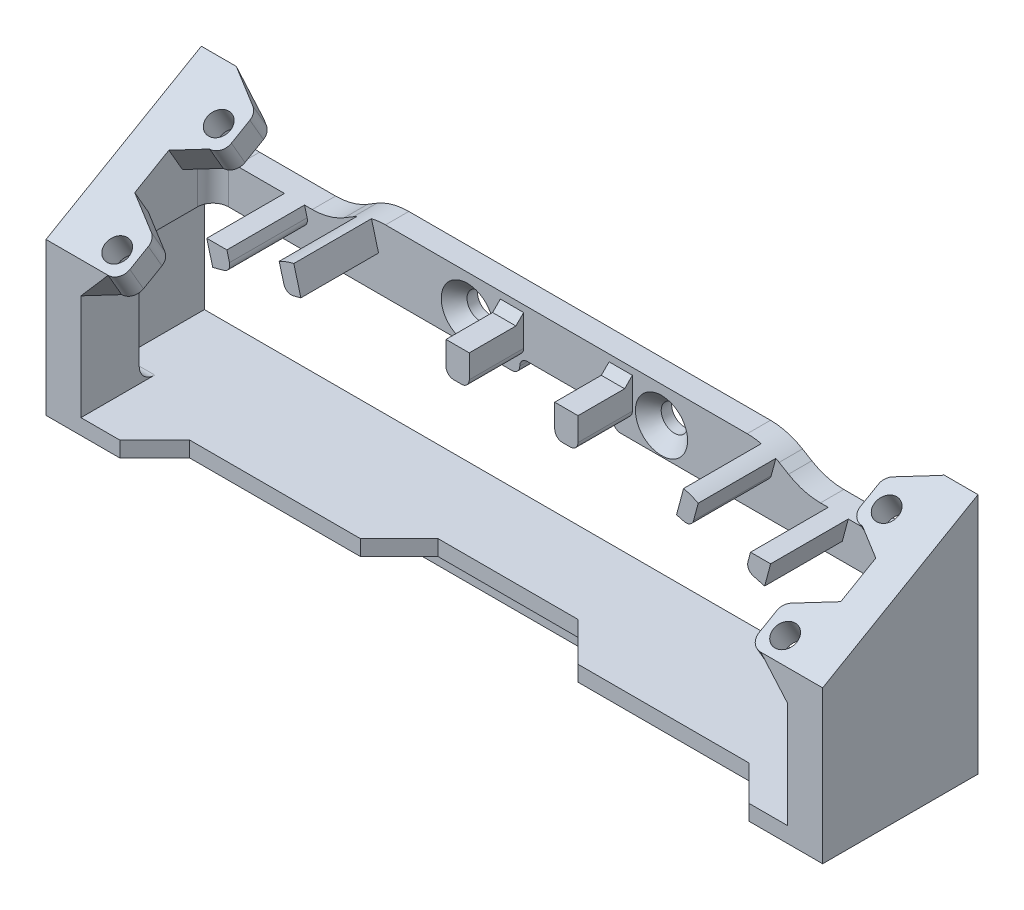
from build123d import *
from OCP.BRepFilletAPI import BRepFilletAPI_MakeChamfer

# Parameters (mm, degrees)
RESSALTO_EXTRUS_O1_DEPTH  = 20
RESSALTO_EXTRUS_O2_DEPTH  = 100
CORTE_EXTRUS_O1_DEPTH     = 100
ESBO_O5_W                 = 91.00000000000001
ESBO_O5_H                 = 5.137292932083099
CORTE_EXTRUS_O2_DEPTH     = 100
CORTE_EXTRUS_O3_DEPTH     = 100
CORTE_EXTRUS_O4_DEPTH     = 100
CORTE_EXTRUS_O5_DEPTH     = 100
RESSALTO_EXTRUS_O6_DEPTH  = 3
FILETE3_R                 = 3
FILETE4_R                 = 8
ESBO_O16_W                = 5
ESBO_O16_H                = 5
ESBO_O16_R                = 1.5000000000000009
ESBO_O16_R_2              = 1.5000000000000042
RESSALTO_EXTRUS_O8_DEPTH  = 3.5
CHANFRO1_SIZE             = 3
CHANFRO1_SIZE_2           = 5.196152423
CHANFRO2_SIZE             = 5
CHANFRO2_SIZE_2           = 2.886751346
FILETE5_R                 = 2
ESBO_O20_W                = 12
ESBO_O20_H                = 2
CORTE_EXTRUS_O6_DEPTH     = 3.5
FILETE6_R                 = 1
ESBO_O21_R                = 2.0000000000000013
ESBO_O21_R_2              = 2.0000000000000036
RESSALTO_EXTRUS_O9_DEPTH  = 3.5
CHANFRO3_SIZE             = 2
CHANFRO3_SIZE2            = 3.4641016151377735
CHANFRO4_SIZE             = 3.5
CHANFRO4_SIZE2            = 2.0207259421636956
CHANFRO5_SIZE             = 2
CHANFRO5_SIZE2            = 3.464101615137773
FILETE7_R                 = 1.5
FILETE8_R                 = 1.5
FILETE9_R                 = 1.5
FILETE10_R                = 2
RESSALTO_EXTRUS_O10_START = 10
RESSALTO_EXTRUS_O10_DEPTH = 10
RESSALTO_EXTRUS_O11_DEPTH = 7
CHANFRO6_SIZE             = 1
RESSALTO_EXTRUS_O12_DEPTH = 0.4
RESSALTO_EXTRUS_O13_DEPTH = 0.4


# Read off the part's stored shape, not the designer's step: Escareado para parafuso Allen sextavado escareado de M32
# Some blends are built 0.0001 mm under size
with BuildPart() as part:
    # Esboço1 → Ressalto-extrusão1 (new body)
    with BuildSketch(Plane.XY):
        Polygon((-34.51828410689169, -80.8139786444684), (-34.518284106891684, -114.0325026371303), (65.4817158931083, -114.0325026371303), (65.4817158931083, -112.03250263713029), (65.4817158931083, -80.81397864446838), (60.98171589310831, -80.8139786444684), (60.981715893108316, -112.03250263713029), (-30.01828410689169, -112.03250263713029), (-30.01828410689169, -80.8139786444684), align=None)
    extrude(amount=RESSALTO_EXTRUS_O1_DEPTH)

    # Esboço3 → Ressalto-extrusão2 (add)
    with BuildSketch(Plane.ZY.offset(34.518284106891706)):
        Polygon((-4.297148019369203, -80.81397864446839), (-4.2971480193692155, -78.81397864446838), (-3.1239530068562695, -78.56176155025109), (0.777001430002814, -80.81397864446839), (0, -80.81397864446839), (0, -82.5325026371303), align=None)
    extrude(amount=-RESSALTO_EXTRUS_O2_DEPTH)

    # Esboço4 → Corte-extrusão1 (cut)
    with BuildSketch(Plane.ZY.offset(34.518284106891706)):
        Polygon((-3.1239530068562695, -78.56176155025109), (20, -91.91238204348795), (20, -78.56176155025109), align=None)
    extrude(amount=-CORTE_EXTRUS_O1_DEPTH, mode=Mode.SUBTRACT)

    # Esboço5 → Corte-extrusão2 (cut)
    with BuildSketch(Plane.XY):
        with Locations((15.481715893108314, -79.96385617108876)):
            Rectangle(ESBO_O5_W, ESBO_O5_H)
    extrude(amount=CORTE_EXTRUS_O2_DEPTH, mode=Mode.SUBTRACT)

    # Esboço6 → Corte-extrusão3 (cut)
    with BuildSketch(Plane(origin=(65.4817158931083, 0, 0), x_dir=(0, 0, -1), z_dir=(1, 0, 0))):
        Polygon((-20, -91.91238204348794), (-20, -94.41238204348794), (0, -82.86537665969512), (0, -82.53250263713029), (4.297148019369203, -80.81397864446838), (4.2971480193692155, -78.81397864446836), (3.1239530068562695, -78.56176155025108), align=None)
    extrude(amount=-CORTE_EXTRUS_O3_DEPTH, mode=Mode.SUBTRACT)

    # Esboço7 → Corte-extrusão4 (cut)
    with BuildSketch(Plane.XZ.offset(114.0325026371303)):
        Polygon((47.98171589310826, 20), (-17.018284106891766, 20.000000000000004), (-25.018284106891734, 20), (-20.518284106891695, 15.499999999999982), (-12.518284106891702, 15.499999999999993), (1.481715893108259, 15.499999999999993), (6.481715893108291, 10.499999999999966), (24.481715893108312, 10.49999999999997), (29.48171589310831, 15.5), (43.48171589310828, 15.499999999999993), (51.48171589310829, 15.499999999999986), (55.98171589310833, 20), align=None)
    extrude(amount=-CORTE_EXTRUS_O4_DEPTH, mode=Mode.SUBTRACT)

    # Esboço9 → Corte-extrusão5 (cut)
    with BuildSketch(Plane.ZY.offset(34.518284106891706)):
        with BuildLine():
            Line((0, -112.03250263713028), (10.499999999999988, -112.03250263713028))
            ThreePointArc((10.499999999999988, -112.03250263713028), (11.914213562373096, -111.44671619950337), (12.5, -110.03250263713026))
            Line((12.5, -110.03250263713026), (12.5, -98.0325026371303))
            ThreePointArc((12.5, -98.0325026371303), (11.914213562373106, -96.61828907475719), (10.499999999999988, -96.03250263713028))
            Line((10.499999999999988, -96.03250263713028), (0, -96.03250263713028))
            Line((0, -96.03250263713028), (0, -112.03250263713028))
        make_face()
    extrude(amount=-CORTE_EXTRUS_O5_DEPTH, mode=Mode.SUBTRACT)

    # Esboço12 → Ressalto-extrusão6 (add)
    with BuildSketch(Plane(origin=(0, 0, 0), x_dir=(-1, 0, 0), z_dir=(0, 0, -1))):
        Polygon((30.018284106891695, -96.03250263713028), (-60.981715893108316, -96.03250263713026), (-60.981715893108316, -90.93190563309287), (-45.981715893108316, -90.93190563309287), (-40.98171589310832, -87.93250263713028), (10.018284106891695, -87.93250263713028), (15.018284106891697, -90.9325026371303), (30.018284106891695, -90.9325026371303), align=None)
    extrude(amount=-RESSALTO_EXTRUS_O6_DEPTH)

    # Filete3
    filete3_edges = [part.edges().sort_by_distance(p)[0] for p in [
        (-30.018284106891695, -90.9325026371303, 1.5),
        (60.981715893108316, -90.93190563309287, 1.5),
    ]]
    fillet(filete3_edges, radius=FILETE3_R)

    # Filete4
    filete4_edges = [part.edges().sort_by_distance(p)[0] for p in [
        (45.981715893108316, -90.93190563309287, 1.5),
        (40.98171589310832, -87.93250263713028, 1.5),
        (-10.018284106891695, -87.93250263713028, 1.5),
        (-15.018284106891697, -90.9325026371303, 1.5),
    ]]
    fillet(filete4_edges, radius=FILETE4_R)

    # Esboço16 → Ressalto-extrusão8 (add)
    # profile 1 of 4: a face of its own
    with BuildSketch(Plane(origin=(0, -62.149032494770566, -35.88176064073152), x_dir=(1, 0, 0), z_dir=(0, 0.8660254037844332, 0.5000000000000098))):
        with Locations((-27.51828410689169, -62.02669909743355)):
            Rectangle(ESBO_O16_W, ESBO_O16_H)
        with Locations(Location((-27.518284106891695, -62.02669909743355, 0), (0, 0, 270))):
            Circle(ESBO_O16_R, mode=Mode.SUBTRACT)
    # profile 2 of 4: a face of its own
    with BuildSketch(Plane(origin=(0, -62.149032494770566, -35.88176064073152), x_dir=(1, 0, 0), z_dir=(0, 0.8660254037844332, 0.5000000000000098))):
        Polygon((-30.01828410689169, -44.432688329848396), (-25.01828410689169, -44.43268832984839), (-25.01828410689169, -49.43268832984839), (-30.01828410689169, -49.43268832984838), align=None)
        with Locations(Location((-27.51828410689169, -46.93268832984838, 0), (0, 0, 270))):
            Circle(ESBO_O16_R, mode=Mode.SUBTRACT)
    # profile 3 of 4: a face of its own
    with BuildSketch(Plane(origin=(0, -62.149032494770566, -35.88176064073152), x_dir=(1, 0, 0), z_dir=(0, 0.8660254037844332, 0.5000000000000098))):
        with Locations((58.48171589310831, -46.93268832984838)):
            Rectangle(ESBO_O16_W, ESBO_O16_H)
        with Locations(Location((58.481715893108316, -46.93268832984838, 0), (0, 0, 270))):
            Circle(ESBO_O16_R_2, mode=Mode.SUBTRACT)
    # profile 4 of 4: a face of its own
    with BuildSketch(Plane(origin=(0, -62.149032494770566, -35.88176064073152), x_dir=(1, 0, 0), z_dir=(0, 0.8660254037844332, 0.5000000000000098))):
        with Locations((58.48171589310832, -62.02669909743355)):
            Rectangle(ESBO_O16_W, ESBO_O16_H)
        with Locations(Location((58.48171589310832, -62.02669909743355, 0), (0, 0, 270))):
            Circle(ESBO_O16_R_2, mode=Mode.SUBTRACT)
    extrude(amount=-RESSALTO_EXTRUS_O8_DEPTH)

    # Chanfro1
    # the kernel refuses this chamfer: 5.196152423, 3 mm, written as the material it adds along each edge
    with BuildSketch(Plane(origin=(-30.01828410689169, -91.91238204348792, 15.66987298107783), x_dir=(-0.057893862402670915, 0.49916137187690596, -0.8645728572665613), z_dir=(0, -0.866025403784433, -0.5000000000000097))) as chanfro1_piece_1_section:
        Polygon((CHANFRO1_SIZE * 0.998322743754, CHANFRO1_SIZE * 0.0578938624027), (-CHANFRO1_SIZE_2 * 0.0578938623994, CHANFRO1_SIZE_2 * 0.998322743697), (0, 0), align=None)
    chanfro1_piece_1 = extrude(amount=3.4999999999999964, mode=Mode.PRIVATE)
    chanfro1_piece_1 = split(chanfro1_piece_1, bisect_by=Plane(origin=(-25.01828410689169, -92.94238152247198, 13.953884410447774), z_dir=(-1, 0, 0)), keep=Keep.TOP, mode=Mode.PRIVATE)
    add(chanfro1_piece_1)
    with BuildSketch(Plane(origin=(-30.01828410689169, -84.3653766596952, 2.598076211353309), x_dir=(-0.057893862402670915, 0.49916137187690596, -0.8645728572665613), z_dir=(0, -0.866025403784433, -0.5000000000000097))) as chanfro1_piece_2_section:
        Polygon((CHANFRO1_SIZE * 0.998322743754, CHANFRO1_SIZE * 0.0578938624027), (-CHANFRO1_SIZE_2 * 0.0578938623994, CHANFRO1_SIZE_2 * 0.998322743697), (0, 0), align=None)
    chanfro1_piece_2 = extrude(amount=3.4999999999999964, mode=Mode.PRIVATE)
    chanfro1_piece_2 = split(chanfro1_piece_2, bisect_by=Plane(origin=(-28.122199845533927, -85.36677606463897, 0), z_dir=(0, 0, 1)), keep=Keep.TOP, mode=Mode.PRIVATE)
    chanfro1_piece_2 = split(chanfro1_piece_2, bisect_by=Plane(origin=(-25.01828410689169, -85.36677606463896, 1.134527306529149), z_dir=(-1, 0, 0)), keep=Keep.TOP, mode=Mode.PRIVATE)
    add(chanfro1_piece_2)

    # Chanfro2
    # the kernel refuses this chamfer: 5, 2.886751346 mm, written as the material it adds along each edge
    with BuildSketch(Plane(origin=(60.98171589310831, -84.36537665969519, 2.5980762113532947), x_dir=(-0.9998132206222079, -0.009663382806350363, 0.01673746999358592), z_dir=(0, -0.866025403784433, -0.5000000000000097))) as chanfro2_piece_1_section:
        Polygon((CHANFRO2_SIZE * 0.999813220622, CHANFRO2_SIZE * 0.0193267656127), (-CHANFRO2_SIZE_2 * 0.0193267656124, CHANFRO2_SIZE_2 * 0.999813220604), (0, 0), align=None)
    chanfro2_piece_1 = extrude(amount=3.4999999999999964, mode=Mode.PRIVATE)
    chanfro2_piece_1 = split(chanfro2_piece_1, bisect_by=Plane(origin=(59.152412382176124, -85.38225843506423, 0), z_dir=(0, 0, 1)), keep=Keep.TOP, mode=Mode.PRIVATE)
    chanfro2_piece_1 = split(chanfro2_piece_1, bisect_by=Plane(origin=(55.98171589310831, -85.38225843506423, 1.1455244740526926), z_dir=(1, 0, 0)), keep=Keep.TOP, mode=Mode.PRIVATE)
    add(chanfro2_piece_1)
    with BuildSketch(Plane(origin=(60.981715893108316, -91.91238204348792, 15.66987298107783), x_dir=(0.05789386240267057, 0.49916137187690596, -0.8645728572665614), z_dir=(0, -0.866025403784433, -0.5000000000000097))) as chanfro2_piece_2_section:
        Polygon((CHANFRO2_SIZE_2 * 0.998322743736, -CHANFRO2_SIZE_2 * 0.0578938624016), (-CHANFRO2_SIZE * 0.0578938624027, -CHANFRO2_SIZE * 0.998322743754), (0, 0), align=None)
    chanfro2_piece_2 = extrude(amount=3.4999999999999964, mode=Mode.PRIVATE)
    chanfro2_piece_2 = split(chanfro2_piece_2, bisect_by=Plane(origin=(55.981715893108316, -92.96347163583633, 13.990413558332182), z_dir=(1, 0, 0)), keep=Keep.TOP, mode=Mode.PRIVATE)
    add(chanfro2_piece_2)

    # Filete5
    # the kernel refuses this fillet: 2 mm, written as the material it adds along each edge
    with BuildSketch(Plane(origin=(-30.01828410689169, -83.63887935159148, 3), x_dir=(1, -4.4e-16, 0), z_dir=(-4.4e-16, -1, 0))) as filete5_piece_1_section:
        with BuildLine():
            CenterArc((FILETE5_R, FILETE5_R), FILETE5_R, 180, 90)
            Line((0, FILETE5_R), (0, 0))
            Line((0, 0), (FILETE5_R, 0))
        make_face()
    filete5_piece_1 = extrude(amount=12.393623285538794, mode=Mode.PRIVATE)
    filete5_piece_1 = filete5_piece_1 - Plane(origin=(-27.01828410689169, -87.9325026371303, 3.456903991083937), x_dir=(0, -1, 0), z_dir=(0, 0, 1)) * Cylinder(3, 33, mode=Mode.PRIVATE)
    filete5_piece_1 = split(filete5_piece_1, bisect_by=Plane(origin=(-29.597914125530636, -86.8317887844861, 6.870027323892917), z_dir=(0, -0.8660254037843289, -0.50000000000019)), keep=Keep.TOP, mode=Mode.PRIVATE)
    add(filete5_piece_1)
    with BuildSketch(Plane(origin=(60.981715893108316, -83.6388793515915, 3), x_dir=(-1, 0, 0), z_dir=(0, -1, 0))) as filete5_piece_2_section:
        with BuildLine():
            CenterArc((FILETE5_R, -FILETE5_R), FILETE5_R, 90, 90)
            Line((0, -FILETE5_R), (0, 0))
            Line((0, 0), (FILETE5_R, 0))
        make_face()
    filete5_piece_2 = extrude(amount=12.393623285538766, mode=Mode.PRIVATE)
    filete5_piece_2 = split(filete5_piece_2, bisect_by=Plane(origin=(60.5613372890969, -89.86282595555873, 5.119937703820557), z_dir=(0, -0.866025403784329, -0.5000000000001898)), keep=Keep.TOP, mode=Mode.PRIVATE)
    filete5_piece_2 = filete5_piece_2 - Plane(origin=(57.981715893108316, -87.93190563309287, 3.456894411082666), x_dir=(1, 0, 0), z_dir=(0, 0, 1)) * Cylinder(3, 33, mode=Mode.PRIVATE)
    add(filete5_piece_2)

    # Esboço20 → Corte-extrusão6 (cut)
    with BuildSketch(Plane.XY.offset(3)):
        with Locations((15.481715893108309, -95.03250263713026)):
            Rectangle(ESBO_O20_W, ESBO_O20_H)
    extrude(amount=-CORTE_EXTRUS_O6_DEPTH, mode=Mode.SUBTRACT)

    # Filete6
    filete6_edges = [part.edges().sort_by_distance(p)[0] for p in [
        (9.481715893108309, -94.03250263713026, 1.5),
        (21.48171589310831, -94.03250263713026, 1.5),
    ]]
    fillet(filete6_edges, radius=FILETE6_R)
    filete6_2_edges = [part.edges().sort_by_distance(p)[0] for p in [
        (9.481715893108309, -96.03250263713026, 1.5),
        (21.48171589310831, -96.03250263713026, 1.5),
    ]]
    fillet(filete6_2_edges, radius=FILETE6_R - 0.0001)  # a hair under: the kernel refuses the full size

    # Esboço21 → Ressalto-extrusão9 (add)
    with BuildSketch(Plane(origin=(0, 0, 0), x_dir=(-1, 0, 0), z_dir=(0, 0, -1))):
        Polygon((12.518284106891688, -124.03250263713026), (-43.48171589310831, -124.03250263713026), (-43.48171589310828, -114.0325026371303), (12.518284106891691, -114.0325026371303), align=None)
        with Locations((3.7682841068917003, -119.90603077455421)):
            Circle(ESBO_O21_R, mode=Mode.SUBTRACT)
        with Locations((-34.731715893108294, -119.90603077455421)):
            Circle(ESBO_O21_R_2, mode=Mode.SUBTRACT)
    extrude(amount=-RESSALTO_EXTRUS_O9_DEPTH)

    # Chanfro3
    chanfro3_edges = [part.edges().sort_by_distance(p)[0] for p in [
        (15.481715893108312, -124.03250263713026, 3.5),
    ]]
    chanfro3_side = [part.faces().sort_by_distance(p)[0] for p in [
        (15.4817158931083, -118.99145664623468, 3.5),
    ]]
    chamfer(chanfro3_edges, length=CHANFRO3_SIZE, length2=CHANFRO3_SIZE2, reference=chanfro3_side[0])

    # Chanfro4: one chamfer whose edges measure the first distance from different faces: ONE call of the kernel's chamfer builder (chamfer() names one face for all edges)
    chanfro4_edges_1 = [part.edges().sort_by_distance(p)[0] for p in [
        (-30.01828410689169, -95.92792650011074, 19.124999999999968),
    ]]
    chanfro4_side_1 = [part.faces().sort_by_distance(p)[0] for p in [
        (-27.51828410689169, -95.92792650011074, 19.124999999999968),
    ]]
    chanfro4_edges_2 = [part.edges().sort_by_distance(p)[0] for p in [
        (-30.01828410689169, -88.380921116318, 6.05320323027544),
    ]]
    chanfro4_side_2 = [part.faces().sort_by_distance(p)[0] for p in [
        (-27.51828410689169, -88.380921116318, 6.053203230275442),
    ]]
    chanfro4 = BRepFilletAPI_MakeChamfer(part.part.solid().wrapped)
    for e in chanfro4_edges_1:
        chanfro4.Add(CHANFRO4_SIZE, CHANFRO4_SIZE2, e.wrapped, chanfro4_side_1[0].wrapped)  # the first distance lies on this face
    for e in chanfro4_edges_2:
        chanfro4.Add(CHANFRO4_SIZE, CHANFRO4_SIZE2, e.wrapped, chanfro4_side_2[0].wrapped)  # the first distance lies on this face
    add(Compound.cast(chanfro4.Shape()), mode=Mode.REPLACE)

    # Chanfro5
    chanfro5_edges = [part.edges().sort_by_distance(p)[0] for p in [
        (60.98171589310831, -88.380921116318, 6.05320323027544),
        (60.981715893108316, -95.92792650011074, 19.124999999999968),
    ]]
    chanfro5_side = [part.faces().sort_by_distance(p)[0] for p in [
        (60.981715893108316, -100.24542387048885, 13.769684480397704),
    ]]
    chamfer(chanfro5_edges, length=CHANFRO5_SIZE, length2=CHANFRO5_SIZE2, reference=chanfro5_side[0])

    # Filete7
    filete7_edges = [part.edges().sort_by_distance(p)[0] for p in [
        (-25.01828410689169, -95.92792650011074, 19.124999999999968),
        (-25.01828410689169, -88.380921116318, 6.0532032302754475),
        (55.98171589310831, -88.380921116318, 6.05320323027544),
        (55.981715893108316, -95.92792650011074, 19.124999999999968),
    ]]
    fillet(filete7_edges, radius=FILETE7_R - 0.0001)  # a hair under: the kernel refuses the full size

    # Filete8
    filete8_edges = [part.edges().sort_by_distance(p)[0] for p in [
        (55.981715893108316, -93.42792650011069, 14.794872981077813),
        (-25.018284106892, -93.37130217308453, 14.696796769724216),
    ]]
    fillet(filete8_edges, radius=FILETE8_R)

    # Filete9
    filete9_edges = [part.edges().sort_by_distance(p)[0] for p in [
        (55.98171589310831, -85.88092111631795, 1.7230762113532778),
        (-25.018284106892, -85.82429678929108, 1.6249999999994797),
    ]]
    fillet(filete9_edges, radius=FILETE9_R)

    # Filete10
    filete10_edges = [part.edges().sort_by_distance(p)[0] for p in [
        (-12.518284106891691, -114.0325026371303, 1.75),
        (43.48171589310828, -114.0325026371303, 1.75),
    ]]
    fillet(filete10_edges, radius=FILETE10_R)

    # Escareado para parafuso Allen sextav 2 → Escareado para parafuso Allen sextavado escareado de M32 (revolve, cut)
    with BuildSketch(Plane(origin=(27.731715893, -92.532502637, 0), x_dir=(1, 0, 0), z_dir=(0, -1, 0))):
        Polygon((0, 0), (1.7, 0), (1.7, 1.34), (3.36, 3), (0, 3), align=None)
    revolve(axis=Axis((27.731715893, -92.532502637, 0), (0, 0, 1)), mode=Mode.SUBTRACT)

    # Escareado para parafuso Allen sextav 3 o → Escareado para parafuso Allen sextav 3 (revolve, cut)
    with BuildSketch(Plane(origin=(2.731715893, -92.532502637, 0), x_dir=(1, 0, 0), z_dir=(0, -1, 0))):
        Polygon((0, 0), (1.7, 0), (1.7, 1.34), (3.36, 3), (0, 3), align=None)
    revolve(axis=Axis((2.731715893, -92.532502637, 0), (0, 0, 1)), mode=Mode.SUBTRACT)

    # Esboço25 → Ressalto-extrusão10 (add)
    with BuildSketch(Plane.XY.offset(3).offset(RESSALTO_EXTRUS_O10_START)):
        with BuildLine():
            Line((41.857787438691325, -91.07164955233681), (42.45714406849767, -88.83482015804626))
            ThreePointArc((42.45714406849767, -88.83482015804626), (41.5369807085434, -88.42764435080417), (40.572983398869475, -88.13919689640909))
            Line((40.572983398869475, -88.13919689640909), (39.66711674101068, -91.51993728842083))
            Line((39.66711674101068, -91.51993728842083), (40.63304256729974, -91.77875633352335))
            ThreePointArc((40.63304256729974, -91.77875633352335), (41.39186161240226, -91.67885591101873), (41.857787438691325, -91.07164955233681))
        make_face()
        with BuildLine():
            Line((51.013782959311484, -93.79787035882808), (49.56489421987766, -93.40964179117518))
            ThreePointArc((49.56489421987766, -93.40964179117518), (48.95768786119542, -92.94371596488608), (48.857787438691105, -92.1848969197836))
            Line((48.857787438691105, -92.1848969197836), (49.193525442083114, -90.93190563309287))
            Line((49.193525442083114, -90.93190563309287), (51.781715893108306, -90.93190563309287))
            Line((51.781715893108306, -90.93190563309287), (51.013782959311484, -93.79787035882808))
        make_face()
        with BuildLine():
            Line((-8.703684954794086, -91.51993728842083), (-9.609551612652881, -88.13919689640909))
            ThreePointArc((-9.609551612652881, -88.13919689640909), (-10.573548922326808, -88.42764435080417), (-11.493712282281077, -88.83482015804626))
            Line((-11.493712282281077, -88.83482015804626), (-10.894355652474735, -91.07164955233681))
            ThreePointArc((-10.894355652474735, -91.07164955233681), (-10.428429826185667, -91.67885591101873), (-9.669610781083152, -91.77875633352335))
            Line((-9.669610781083152, -91.77875633352335), (-8.703684954794086, -91.51993728842083))
        make_face()
        with BuildLine():
            Line((-18.230093655866515, -90.93190563309287), (-20.818284106891717, -90.93190563309287))
            Line((-20.818284106891717, -90.93190563309287), (-20.050351173094892, -93.79787035882808))
            Line((-20.050351173094892, -93.79787035882808), (-18.601462433661236, -93.40964179117451))
            ThreePointArc((-18.601462433661236, -93.40964179117451), (-17.99425607497924, -92.94371596488543), (-17.894355652474687, -92.1848969197829))
            Line((-17.894355652474687, -92.1848969197829), (-18.230093655866515, -90.93190563309287))
        make_face()
    extrude(amount=-RESSALTO_EXTRUS_O10_DEPTH)

    # Esboço26 → Ressalto-extrusão11 (add)
    with BuildSketch(Plane.XY.offset(3)):
        with BuildLine():
            Line((20.981715893108305, -89.81013093885063), (23.981715893108305, -89.81013093885063))
            Line((23.981715893108305, -89.81013093885063), (23.981715893108305, -92.81013093885063))
            ThreePointArc((23.981715893108305, -92.81013093885063), (23.688822674294858, -93.51723772003719), (22.981715893108294, -93.81013093885065))
            Line((22.981715893108294, -93.81013093885065), (21.981715893108316, -93.81013093885065))
            ThreePointArc((21.981715893108316, -93.81013093885065), (21.274609111921762, -93.51723772003719), (20.98171589310831, -92.81013093885063))
            Line((20.98171589310831, -92.81013093885063), (20.981715893108305, -89.81013093885063))
        make_face()
        with BuildLine():
            Line((9.981715893108305, -89.81013093885063), (6.981715893108306, -89.81013093885063))
            Line((6.981715893108306, -89.81013093885063), (6.981715893108307, -92.81013093885063))
            ThreePointArc((6.981715893108307, -92.81013093885063), (7.274609111921752, -93.51723772003719), (7.981715893108313, -93.81013093885065))
            Line((7.981715893108313, -93.81013093885065), (8.981715893108296, -93.81013093885065))
            ThreePointArc((8.981715893108296, -93.81013093885065), (9.68882267429485, -93.51723772003719), (9.981715893108305, -92.81013093885063))
            Line((9.981715893108305, -92.81013093885063), (9.981715893108305, -89.81013093885063))
        make_face()
    extrude(amount=RESSALTO_EXTRUS_O11_DEPTH)

    # Chanfro6
    chanfro6_edges = [part.edges().sort_by_distance(p)[0] for p in [
        (22.481715893108305, -89.81013093885063, 3),
        (8.481715893108305, -89.81013093885063, 3),
    ]]
    chamfer(chanfro6_edges, length=CHANFRO6_SIZE)

    # Esboço27 → Ressalto-extrusão12 (add)
    with BuildSketch(Plane.ZY.offset(34.518284106891706)):
        Polygon((20, -94.41238204348792), (0, -96.03250263713028), (0, -114.03250263713029), (20, -114.03250263713029), align=None)
    extrude(amount=-RESSALTO_EXTRUS_O12_DEPTH)

    # Esboço28 → Ressalto-extrusão13 (add)
    with BuildSketch(Plane(origin=(65.4817158931083, 0, 0), x_dir=(0, 0, -1), z_dir=(1, 0, 0))):
        Polygon((0, -114.0325026371303), (-20, -114.0325026371303), (-20, -94.41238204348794), (0, -96.03250263713026), align=None)
    extrude(amount=-RESSALTO_EXTRUS_O13_DEPTH)


solid = part.part
